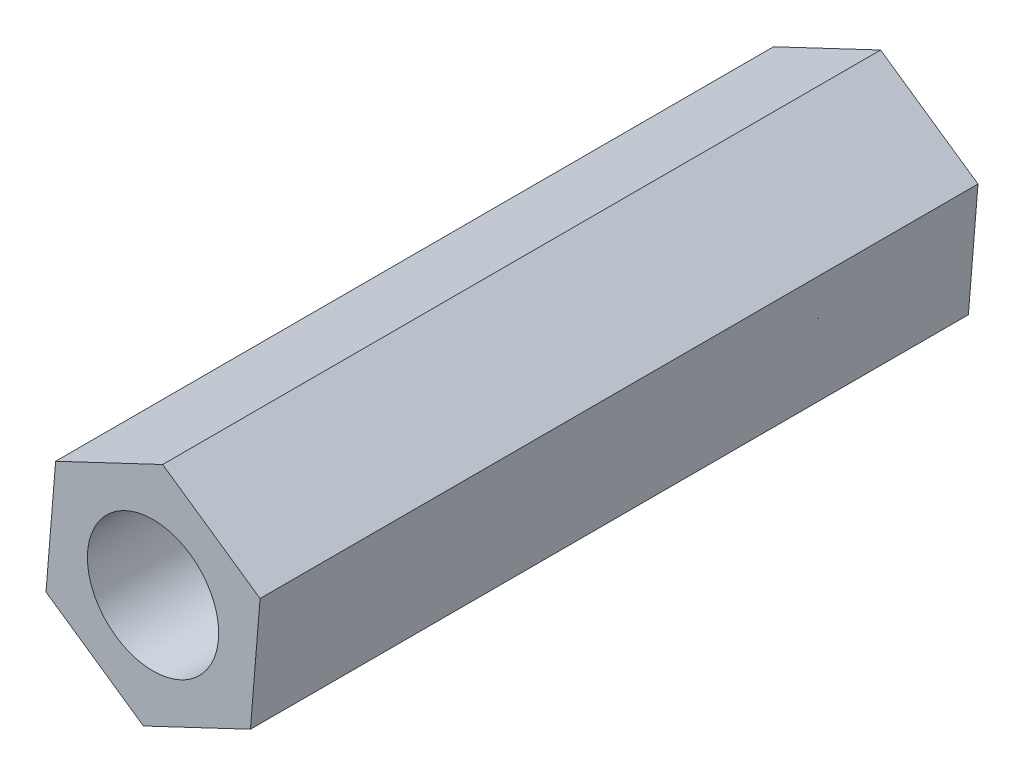
from build123d import *

# Parameters (mm, degrees)
BOSS_EXTRUDE1_DEPTH = 5
SKETCH2_R           = 1.6
CUT_EXTRUDE1_DEPTH  = 5
BOSS_EXTRUDE2_DEPTH = 12.5
CUT_EXTRUDE2_START  = -12.5
SKETCH4_R           = 1.6
CUT_EXTRUDE2_DEPTH  = 12.5


with BuildPart() as part:
    # Sketch1 → Boss-Extrude1 (new body)
    with BuildSketch(Plane.XY):
        Polygon((-2.374519268, 1.641642951), (-2.608964134, -1.235572533), (-0.234444865, -2.877215483), (2.374519268, -1.641642951), (2.608964134, 1.235572533), (0.234444865, 2.877215483), align=None)
    extrude(amount=BOSS_EXTRUDE1_DEPTH)

    # Sketch2 → Cut-Extrude1 (cut)
    with BuildSketch(Plane.XY.offset(5)):
        Circle(SKETCH2_R)
    extrude(amount=-CUT_EXTRUDE1_DEPTH, mode=Mode.SUBTRACT)

    # Sketch3 → Boss-Extrude2 (add)
    with BuildSketch(Plane.XY.offset(5)):
        Polygon((-0.234444865, -2.877215483), (2.374519268, -1.641642951), (2.608964134, 1.235572533), (0.234444865, 2.877215483), (-2.374519268, 1.641642951), (-2.608964134, -1.235572533), align=None)
    extrude(amount=BOSS_EXTRUDE2_DEPTH)

    # Sketch4 → Cut-Extrude2 (cut)
    with BuildSketch(Plane(origin=(0, 0, 5), x_dir=(-1, 0, 0), z_dir=(0, 0, -1)).offset(CUT_EXTRUDE2_START)):
        Circle(SKETCH4_R)
    extrude(amount=CUT_EXTRUDE2_DEPTH, mode=Mode.SUBTRACT)


solid = part.part
